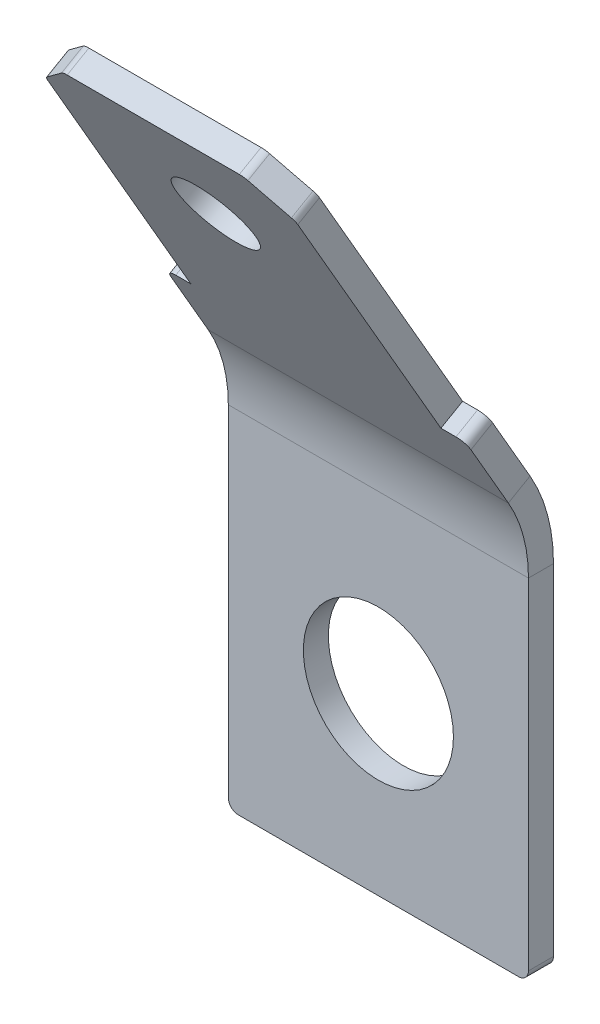
from build123d import *

# Parameters (mm, degrees)
SKETCH_1_W             = 6
SKETCH_1_H             = 7
SM_BASE_FLANGE_1_DEPTH = 0.5
SM_EDGE_FLANGE_1_DEPTH = 6
SKETCH_11_R            = 1.5
CUT_EXTRUDE_1_DEPTH    = 14.480541017
CUT_EXTRUDE_2_REACH    = 15.287
SKETCH_12_R            = 0.8
OTHER_START            = 2.151923789
OTHER_1_DEPTH          = 0.5
OTHER_START_2          = -0.5
OTHER_1_2_DEPTH        = 0.5


# Read off the part's stored shape, not the designer's step: Затупленный угол1
# Sheet-metal steps are written as plain solids
with BuildPart() as part:
    # Sketch 1 → Базовая кромка1 (new body)
    with BuildSketch(Plane.XY):
        Rectangle(SKETCH_1_W, SKETCH_1_H)
    extrude(amount=-SM_BASE_FLANGE_1_DEPTH)

    # Ребро-кромка1 section (across the edge) → Ребро-кромка1 (add)
    with BuildSketch(Plane(origin=(3, 4.303847577, 0), x_dir=(0, -0.49999999999999495, 0.8660254037844416), z_dir=(-1, 0, 0))):
        with BuildLine():
            Line((-0.5, 0.803847577), (-0.5, 9))
            Line((-0.5, 9), (0, 9))
            Line((0, 9), (0, 0.803847577))
            ThreePointArc((0, 0.803847577), (0.102222521, 0.027390442), (0.401923789, -0.696152423))
            Line((0.401923789, -0.696152423), (-0.031088913, -0.946152423))
            ThreePointArc((-0.031088913, -0.946152423), (-0.380740392, -0.102019081), (-0.5, 0.803847577))
        make_face()
    extrude(amount=SM_EDGE_FLANGE_1_DEPTH)

    # Эскиз11 → Вырез-Вытянуть1 (cut, through all)
    with BuildSketch(Plane.XY):
        Circle(SKETCH_11_R)
    extrude(amount=-CUT_EXTRUDE_1_DEPTH, mode=Mode.SUBTRACT)

    # Эскиз12 → Вырез-Вытянуть2 (cut, up to next)
    with BuildSketch(Plane(origin=(0, 1.075961894, -1.863620668), x_dir=(1, 0, 0), z_dir=(0, -0.4999999999999949, 0.8660254037844416)), mode=Mode.PRIVATE) as cut_extrude_2_sk1:
        with Locations(Location((0, 10.227241336, 0), (0, 0, 270))):
            Circle(SKETCH_12_R)
    cut_extrude_2_tool1 = extrude(cut_extrude_2_sk1.sketch, amount=-CUT_EXTRUDE_2_REACH, mode=Mode.PRIVATE) & part.part
    # Эскиз12 → Вырез-Вытянуть2 (cut, up to next)
    with BuildSketch(Plane(origin=(0, 1.075961894, -1.863620668), x_dir=(1, 0, 0), z_dir=(0, -0.4999999999999949, 0.8660254037844416)), mode=Mode.PRIVATE) as cut_extrude_2_sk2:
        Polygon((-1.803847577, 12.727241336), (-2.5, 12.031088913), (-2.5, 6.227241336), (-3, 6.227241336), (-3, 12.727241336), align=None)
    cut_extrude_2_tool2 = extrude(cut_extrude_2_sk2.sketch, amount=-CUT_EXTRUDE_2_REACH, mode=Mode.PRIVATE) & part.part
    # Эскиз12 → Вырез-Вытянуть2 (cut, up to next)
    with BuildSketch(Plane(origin=(0, 1.075961894, -1.863620668), x_dir=(1, 0, 0), z_dir=(0, -0.4999999999999949, 0.8660254037844416)), mode=Mode.PRIVATE) as cut_extrude_2_sk3:
        Polygon((3, 12.727241336), (1.803847577, 12.727241336), (2.5, 12.031088913), (2.5, 6.227241336), (3, 6.227241336), align=None)
    cut_extrude_2_tool3 = extrude(cut_extrude_2_sk3.sketch, amount=-CUT_EXTRUDE_2_REACH, mode=Mode.PRIVATE) & part.part
    add(cut_extrude_2_tool1.solids().sort_by_distance((0, 9.933013, 3.25))[0], mode=Mode.SUBTRACT)
    add(cut_extrude_2_tool2.solids().sort_by_distance((-2.716553, 9.46484, 2.9797))[0], mode=Mode.SUBTRACT)
    add(cut_extrude_2_tool3.solids().sort_by_distance((2.716553, 9.46484, 2.9797))[0], mode=Mode.SUBTRACT)

    # Other 1 outline → Other 1 (cut)
    with BuildSketch(Plane(origin=(0, 0, 0), x_dir=(1, 0, 0), z_dir=(0, 0.4999999999999948, -0.8660254037844417)).offset(OTHER_START)):
        with BuildLine():
            Line((-3, -6.227241336), (-2.8, -6.227241336))
            ThreePointArc((-2.8, -6.227241336), (-2.941421356, -6.168662692), (-3, -6.027241336))
            Line((-3, -6.027241336), (-3, -6.227241336))
        make_face()
        with BuildLine():
            Line((-2.5, -12.031088913), (-2.441421356, -12.089667557))
            ThreePointArc((-2.441421356, -12.089667557), (-2.484775907, -12.024782888), (-2.5, -11.948246201))
            Line((-2.5, -11.948246201), (-2.5, -12.031088913))
        make_face()
        with BuildLine():
            Line((-1.803847577, -12.727241336), (-1.721004865, -12.727241336))
            ThreePointArc((-1.721004865, -12.727241336), (-1.797541551, -12.712017242), (-1.862426221, -12.668662692))
            Line((-1.862426221, -12.668662692), (-1.803847577, -12.727241336))
        make_face()
        with BuildLine():
            Line((1.803847577, -12.727241336), (1.862426221, -12.668662692))
            ThreePointArc((1.862426221, -12.668662692), (1.797541551, -12.712017242), (1.721004865, -12.727241336))
            Line((1.721004865, -12.727241336), (1.803847577, -12.727241336))
        make_face()
        with BuildLine():
            Line((2.5, -12.031088913), (2.5, -11.948246201))
            ThreePointArc((2.5, -11.948246201), (2.484775907, -12.024782888), (2.441421356, -12.089667557))
            Line((2.441421356, -12.089667557), (2.5, -12.031088913))
        make_face()
        with BuildLine():
            ThreePointArc((3, -6.027241336), (2.941421356, -6.168662692), (2.8, -6.227241336))
            Line((2.8, -6.227241336), (3, -6.227241336))
            Line((3, -6.227241336), (3, -6.027241336))
        make_face()
    extrude(amount=OTHER_1_DEPTH, mode=Mode.SUBTRACT)

    # Other 1 2 outline → Other 1 2 (cut)
    with BuildSketch(Plane.XY.offset(OTHER_START_2)):
        with BuildLine():
            ThreePointArc((3, -3.3), (2.941421356, -3.441421356), (2.8, -3.5))
            Line((2.8, -3.5), (3, -3.5))
            Line((3, -3.5), (3, -3.3))
        make_face()
        with BuildLine():
            ThreePointArc((-2.8, -3.5), (-2.941421356, -3.441421356), (-3, -3.3))
            Line((-3, -3.3), (-3, -3.5))
            Line((-3, -3.5), (-2.8, -3.5))
        make_face()
    extrude(amount=OTHER_1_2_DEPTH, mode=Mode.SUBTRACT)


solid = part.part
